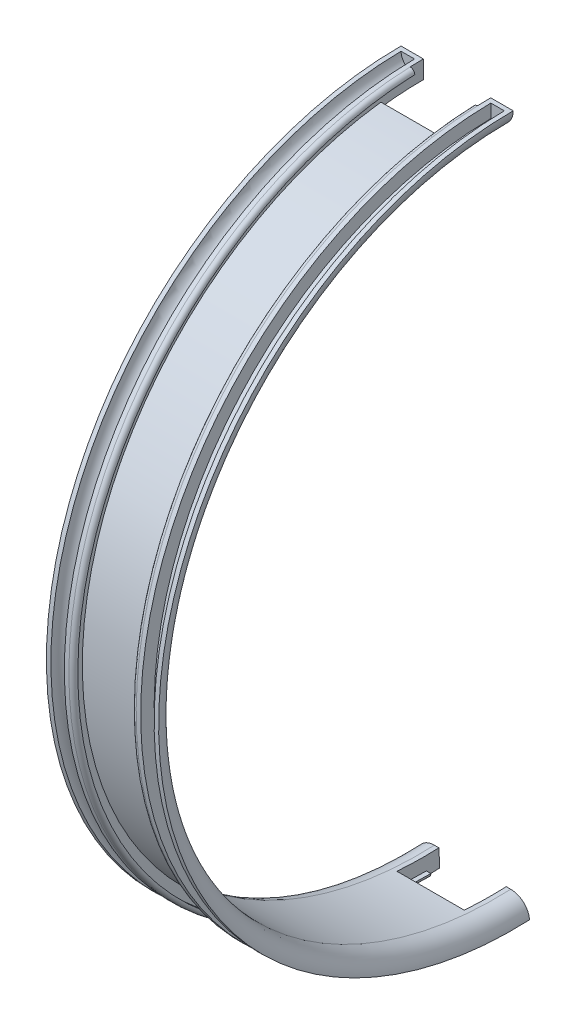
from build123d import *
from build123d.topology import SkipClean

# Parameters (mm, degrees)
REVOLUCI_N1_ANGLE        = 182.6302472
REVOLUCI_N2_ANGLE        = 0.72
REVOLUCI_N3_ANGLE        = 0.72
CROQUIS4_W               = 15
CROQUIS4_H               = 1
CORTAR_REVOLUCI_N3_ANGLE = 7.16
CROQUIS5_W               = 15
CROQUIS5_H               = 1
CORTAR_REVOLUCI_N4_ANGLE = 7.16
CROQUIS6_W               = 1.873912053
CROQUIS6_H               = 1.827754735
CORTAR_REVOLUCI_N5_ANGLE = 2.15
CROQUIS7_W               = 3.385576588
CROQUIS7_H               = 1.666836654
CROQUIS7_W_2             = 2.625324641
CROQUIS7_H_2             = 1.381038994
CORTAR_REVOLUCI_N6_ANGLE = 2.15


with BuildPart() as part:
    # Croquis1 → Revolución1 (revolve)
    with BuildSketch(Plane.XY):
        with BuildLine():
            Line((8.572789227, 10.511435072), (7.572789227, 10.511435072))
            ThreePointArc((7.572789227, 10.511435072), (6.694109568, 8.390114726), (4.57278922, 7.511435072))
            Line((4.57278922, 7.511435072), (4.572789227, 10.511435072))
            Line((4.572789227, 10.511435072), (3.572789227, 10.511435072))
            ThreePointArc((3.572789227, 10.511435072), (2.865682446, 10.218541853), (2.572789227, 9.511435072))
            Line((2.572789227, 9.511435072), (3.572789227, 9.511435072))
            Line((3.572789227, 9.511435072), (3.572789227, 7.511435072))
            Line((3.572789227, 7.511435072), (-11.427210773, 7.511435072))
            Line((-11.427210773, 7.511435072), (-11.427210773, 9.511435072))
            Line((-11.427210773, 9.511435072), (-10.427210773, 9.511435072))
            ThreePointArc((-10.427210773, 9.511435072), (-10.720103992, 10.218541853), (-11.427210773, 10.511435072))
            Line((-11.427210773, 10.511435072), (-12.427210773, 10.511435072))
            Line((-12.427210773, 10.511435072), (-12.427210773, 7.511435072))
            ThreePointArc((-12.427210773, 7.511435072), (-14.548531117, 8.390114728), (-15.427210773, 10.511435072))
            Line((-15.427210773, 10.511435072), (-16.427210773, 10.511435072))
            ThreePointArc((-16.427210773, 10.511435072), (-15.255637898, 7.683007947), (-12.427210773, 6.511435072))
            Line((-12.427210773, 6.511435072), (4.572789227, 6.511435072))
            ThreePointArc((4.572789227, 6.511435072), (7.401216352, 7.683007947), (8.572789227, 10.511435072))
        make_face()
    revolve(axis=Axis((-12.427210773, -68.488564928, 0), (1, 0, 0)), revolution_arc=REVOLUCI_N1_ANGLE)

    # Croquis2 → Revolución2 (revolve)
    with BuildSketch(Plane(origin=(0, 0, 0), x_dir=(-1, 0, 0), z_dir=(0, 0, -1))):
        with BuildLine():
            ThreePointArc((-7.572789227, 10.511435072), (-6.69410957, 8.390114728), (-4.572789227, 7.511435072))
            Line((-4.572789227, 7.511435072), (-4.572789227, 10.511435072))
            Line((-4.572789227, 10.511435072), (-7.572789227, 10.511435072))
        make_face()
        with BuildLine():
            Line((12.427210773, 10.511435072), (12.427210773, 7.511435072))
            ThreePointArc((12.427210773, 7.511435072), (14.548531117, 8.390114728), (15.427210773, 10.511435072))
            Line((15.427210773, 10.511435072), (12.427210773, 10.511435072))
        make_face()
    revolve(axis=Axis((-11.427210773, -68.488564928, 0), (1, 0, 0)), revolution_arc=REVOLUCI_N2_ANGLE)

    # Croquis3 → Revolución3 (revolve)
    with SkipClean():  # the faces are left unmerged after this step: merging them gives an invalid solid
        with BuildSketch(Plane(origin=(0, -0.144231738, 3.139653156), x_dir=(-1, 0, 0), z_dir=(0, 0.04589035156328897, -0.9989464828675247))):
            with BuildLine():
                Line((12.427210773, -147.416411052), (15.427210773, -147.416411052))
                ThreePointArc((15.427210773, -147.416411052), (14.548531117, -145.295090708), (12.427210773, -144.416411052))
                Line((12.427210773, -144.416411052), (12.427210773, -147.416411052))
            make_face()
            with BuildLine():
                Line((-7.572789227, -147.416411052), (-4.572789227, -147.416411052))
                Line((-4.572789227, -147.416411052), (-4.572789227, -144.416411052))
                ThreePointArc((-4.572789227, -144.416411052), (-6.69410957, -145.295090708), (-7.572789227, -147.416411052))
            make_face()
        revolve(axis=Axis((-3.927210773, -68.488564928, 0), (-1, 0, 0)), revolution_arc=REVOLUCI_N3_ANGLE)

    # Croquis4 → Cortar-Revolución3 (revolve, cut)
    with SkipClean():  # the faces are left unmerged after this step: merging them gives an invalid solid
        with BuildSketch(Plane(origin=(0, 0, 0), x_dir=(-1, 0, 0), z_dir=(0, 0, -1))):
            with Locations((3.927210773, 7.011435072)):
                Rectangle(CROQUIS4_W, CROQUIS4_H)
        revolve(axis=Axis((3.572789227, -68.488564928, 0), (1, 0, 0)), revolution_arc=CORTAR_REVOLUCI_N3_ANGLE, mode=Mode.SUBTRACT)

    # Croquis5 → Cortar-Revolución4 (revolve, cut)
    with SkipClean():  # the faces are left unmerged after this step: merging them gives an invalid solid
        with BuildSketch(Plane(origin=(0, -0.144231738, 3.139653156), x_dir=(-1, 0, 0), z_dir=(0, 0.04589035156328897, -0.9989464828675247))):
            with Locations((3.927210773, -143.916411052)):
                Rectangle(CROQUIS5_W, CROQUIS5_H)
        revolve(axis=Axis((3.572789227, -68.488564928, 0), (-1, 0, 0)), revolution_arc=CORTAR_REVOLUCI_N4_ANGLE, mode=Mode.SUBTRACT)

    # Croquis6 → Cortar-Revolución5 (revolve, cut)
    with SkipClean():  # the faces are left unmerged after this step: merging them gives an invalid solid
        with BuildSketch(Plane(origin=(0, -0.144231738, 3.139653156), x_dir=(-1, 0, 0), z_dir=(0, 0.04589035156328897, -0.9989464828675247))):
            with BuildLine():
                Line((-3.572789227, -146.416411052), (-3.572789227, -147.416411052))
                ThreePointArc((-3.572789227, -147.416411052), (-2.865682446, -147.123517833), (-2.572789227, -146.416411052))
                Line((-2.572789227, -146.416411052), (-3.572789227, -146.416411052))
            make_face()
            with Locations((10.490254746, -147.330288419)):
                Rectangle(CROQUIS6_W, CROQUIS6_H)
        revolve(axis=Axis((3.572789227, -68.488564928, 0), (-1, 0, 0)), revolution_arc=CORTAR_REVOLUCI_N5_ANGLE, mode=Mode.SUBTRACT)

    # Croquis7 → Cortar-Revolución6 (revolve, cut)
    with SkipClean():  # the faces are left unmerged after this step: merging them gives an invalid solid
        with BuildSketch(Plane(origin=(0, 0, 0), x_dir=(-1, 0, 0), z_dir=(0, 0, -1))):
            with Locations((-1.880000933, 10.344853399)):
                Rectangle(CROQUIS7_W, CROQUIS7_H)
            with Locations((10.114548452, 10.201954569)):
                Rectangle(CROQUIS7_W_2, CROQUIS7_H_2)
        revolve(axis=Axis((3.572789227, -68.488564928, 0), (1, 0, 0)), revolution_arc=CORTAR_REVOLUCI_N6_ANGLE, mode=Mode.SUBTRACT)


solid = part.part
